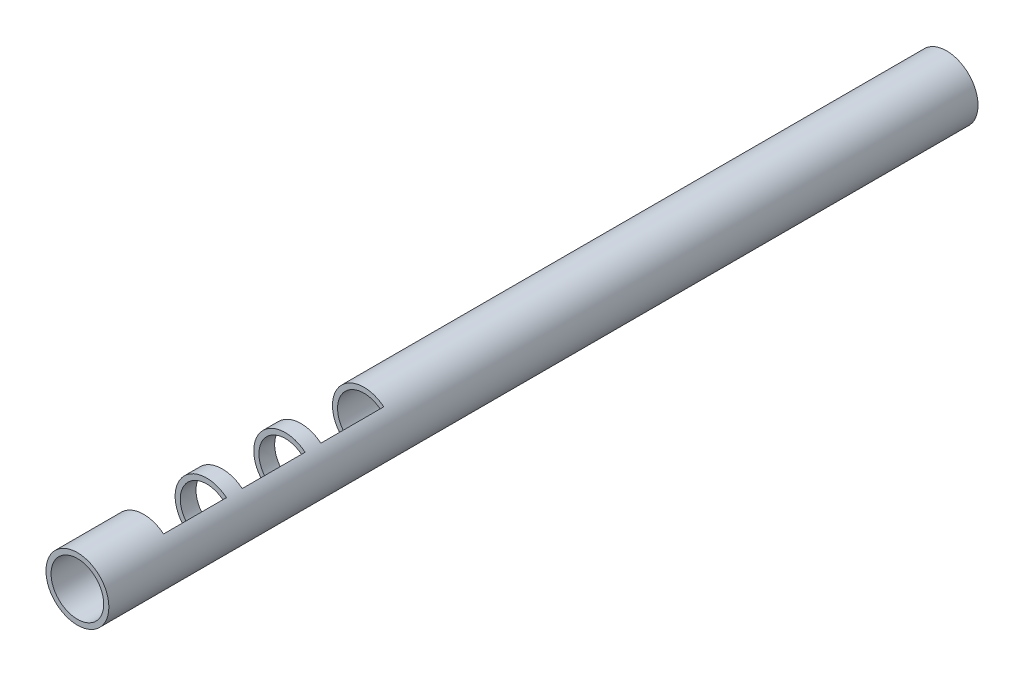
from build123d import *

# Parameters (mm, degrees)
SURFACE_EXTRUDE1_1_DEPTH   = 1.866
SURFACE_TRIM1_TOOL_2_BACK  = 3.327
SURFACE_TRIM1_TOOL_2_DEPTH = 6.654
THICKEN2_T1                = 0.101386
LPATTERN3_COUNT            = 3
LPATTERN3_PITCH            = 1.555
BOSS_EXTRUDE1_DEPTH        = 11.21
BOSS_EXTRUDE2_DEPTH        = 1
SKETCH7_R                  = 0.2
CUT_EXTRUDE2_DEPTH         = 12.244459436


with BuildPart() as body_1:
    # Surface-Extrude1: a surface, the sketch's curves swept straight by 1.866 mm
    with BuildLine(Plane.XY, mode=Mode.PRIVATE) as surface_extrude1_1_path:
        ThreePointArc((0.622, 0), (0, 0.622), (-0.622, 0))
    surface_extrude1_1 = Shell.extrude(surface_extrude1_1_path.wire(), (0 * SURFACE_EXTRUDE1_1_DEPTH, 0 * SURFACE_EXTRUDE1_1_DEPTH, 1 * SURFACE_EXTRUDE1_1_DEPTH))
    # Surface-Trim1 tool: a surface, the sketch's curves swept straight by 6.654 mm
    with BuildLine(Plane(origin=(0, 0, 0), x_dir=(1, 0, 0), z_dir=(0, 1, 0)).offset(-SURFACE_TRIM1_TOOL_2_BACK), mode=Mode.PRIVATE) as surface_trim1_tool_2_path:
        Line((-0.622, -1.555), (0.3932, -1.555))
        Line((0.3932, -1.555), (0.3932, -0.311))
        Line((0.3932, -0.311), (-0.622, -0.311))
    surface_trim1_tool_2 = Shell.extrude(surface_trim1_tool_2_path.wire(), (0 * SURFACE_TRIM1_TOOL_2_DEPTH, 1 * SURFACE_TRIM1_TOOL_2_DEPTH, 0 * SURFACE_TRIM1_TOOL_2_DEPTH))
    # Surface-Trim1: the surface trimmed, the side behind the tool kept
    surface_trim1_3 = split(surface_extrude1_1.faces()[0], bisect_by=surface_trim1_tool_2, keep=Keep.BOTTOM).faces()[0]
    add(Solid.thicken(surface_trim1_3, THICKEN2_T1))


with BuildPart() as lpattern3_1:
    # LPattern3: pattern copy
    add(body_1.part.moved(Location(Vector(0, 0, 1) * (1 * LPATTERN3_PITCH))))


with BuildPart() as lpattern3_2:
    # LPattern3: pattern copy
    add(body_1.part.moved(Location(Vector(0, 0, 1) * (2 * LPATTERN3_PITCH))))


with BuildPart() as body_1_1:
    add(body_1.part)

    # Combine1: read off the stored shape, not the designer's step
    # Combine1: union LPattern3_2, LPattern3_1
    add(lpattern3_2.part)
    add(lpattern3_1.part)

    # Sketch5 → Boss-Extrude1 (add)
    with BuildSketch(Plane(origin=(0, 0, 0), x_dir=(-1, 0, 0), z_dir=(0, 0, -1))):
        with BuildLine():
            Line((-0.622, 0), (-0.520614, 0))
            ThreePointArc((-0.520614, 0), (0, 0.520614), (0.520614, 0))
            Line((0.520614, 0), (0.622, 0))
            ThreePointArc((0.622, 0), (0, 0.622), (-0.622, 0))
        make_face()
    extrude(amount=BOSS_EXTRUDE1_DEPTH)

    # Sketch6 → Boss-Extrude2 (add)
    with BuildSketch(Plane.XY.offset(4.976)):
        with BuildLine():
            Line((-0.622, 0), (-0.520614, 0))
            ThreePointArc((-0.520614, 0), (0, 0.520614), (0.520614, 0))
            Line((0.520614, 0), (0.622, 0))
            ThreePointArc((0.622, 0), (0, 0.622), (-0.622, 0))
        make_face()
    extrude(amount=BOSS_EXTRUDE2_DEPTH)

    # Sketch7 → Cut-Extrude2 (cut, through all)
    with BuildSketch(Plane(origin=(0, 0, 0), x_dir=(0, 0, -1), z_dir=(1, 0, 0))):
        with Locations((-5.165, 0)):
            Circle(SKETCH7_R)
    extrude(amount=-CUT_EXTRUDE2_DEPTH, mode=Mode.SUBTRACT)

    # Mirror1: body 1 across face


with BuildPart() as body_1_2:
    add(body_1_1.part)
    add(body_1_1.part.mirror(Plane(origin=(0.571307, 0, -2.617), x_dir=(0, 0, 1), z_dir=(0, -1, 0))))


solid = body_1_2.part
